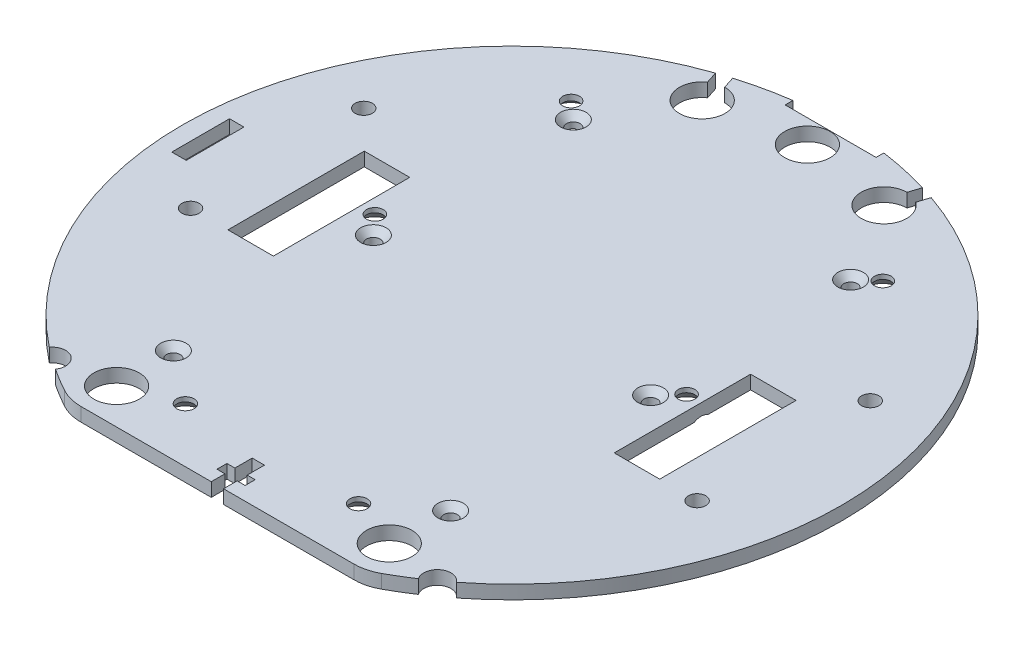
from build123d import *
from OCP.BRepFilletAPI import BRepFilletAPI_MakeChamfer

# Parameters (mm, degrees)
SKETCH1_W           = 3.175
SKETCH1_H           = 12.7
BOSS_EXTRUDE1_DEPTH = 3
SKETCH2_R           = 1.5
CUT_EXTRUDE1_DEPTH  = 103.574363269
CHAMFER1_SIZE       = 1.5
CHAMFER1_SIZE2      = 1.303930107
CUT_EXTRUDE2_DEPTH  = 103.574363269
SKETCH4_W           = 20
SKETCH4_H           = 1.7
CUT_EXTRUDE3_DEPTH  = 103.574363269
SKETCH5_R           = 5
CUT_EXTRUDE4_DEPTH  = 103.085748271
SKETCH6_R           = 1.8415
CUT_EXTRUDE5_DEPTH  = 103.085748271
SKETCH8_R           = 1.905
SKETCH8_W           = 10
SKETCH8_H           = 30
CUT_EXTRUDE7_DEPTH  = 103.085748271
CHAMFER2_SIZE       = 2
CHAMFER2_SIZE_2     = 1.738573476


with BuildPart() as part:
    # Sketch1 → Boss-Extrude1 (new body)
    with BuildSketch(Plane(origin=(0, 0, 0), x_dir=(1, 0, 0), z_dir=(0, 1, 0))):
        with BuildLine():
            Line((30.029977361, -64.812867647), (-30.029977361, -64.812867647))
            ThreePointArc((-30.029977361, -64.812867647), (-32.509837414, -64.500503794), (-34.834773739, -63.582926471))
            ThreePointArc((-34.834773739, -63.582926471), (0, 72.5), (34.834773739, -63.582926471))
            ThreePointArc((34.834773739, -63.582926471), (32.509837414, -64.500503794), (30.029977361, -64.812867647))
        make_face()
        with Locations((-66.9125, 0)):
            Rectangle(SKETCH1_W, SKETCH1_H, mode=Mode.SUBTRACT)
    extrude(amount=BOSS_EXTRUDE1_DEPTH)

    # Sketch2 → Cut-Extrude1 (cut, through all)
    with BuildSketch(Plane(origin=(0, 3, 0), x_dir=(1, 0, 0), z_dir=(0, 1, 0))):
        with Locations(Location((-30.5, 44, 0), (0, 0, 270))):
            Circle(SKETCH2_R)
        with Locations(Location((30.5, 44, 0), (0, 0, 270))):
            Circle(SKETCH2_R)
        with Locations(Location((30.5, 0, 0), (0, 0, 270))):
            Circle(SKETCH2_R)
        with Locations(Location((30.5, -44, 0), (0, 0, 270))):
            Circle(SKETCH2_R)
        with Locations(Location((-30.5, -44, 0), (0, 0, 270))):
            Circle(SKETCH2_R)
        with Locations(Location((-30.5, 0, 0), (0, 0, 270))):
            Circle(SKETCH2_R)
    extrude(amount=-CUT_EXTRUDE1_DEPTH, mode=Mode.SUBTRACT)

    # Chamfer1: one chamfer whose edges measure the first distance from different faces: ONE call of the kernel's chamfer builder (chamfer() names one face for all edges)
    chamfer1_edges_1 = [part.edges().sort_by_distance(p)[0] for p in [
        (-30.5, 3, -45.5),
    ]]
    chamfer1_side_1 = [part.faces().sort_by_distance(p)[0] for p in [
        (-30.5, 1.5, -45.5),
    ]]
    chamfer1_edges_2 = [part.edges().sort_by_distance(p)[0] for p in [
        (-30.5, 3, -1.5),
    ]]
    chamfer1_side_2 = [part.faces().sort_by_distance(p)[0] for p in [
        (-30.5, 1.5, -1.5),
    ]]
    chamfer1_edges_3 = [part.edges().sort_by_distance(p)[0] for p in [
        (-30.5, 3, 42.5),
    ]]
    chamfer1_side_3 = [part.faces().sort_by_distance(p)[0] for p in [
        (-30.5, 1.5, 42.5),
    ]]
    chamfer1_edges_4 = [part.edges().sort_by_distance(p)[0] for p in [
        (30.5, 3, 42.5),
    ]]
    chamfer1_side_4 = [part.faces().sort_by_distance(p)[0] for p in [
        (30.5, 1.5, 42.5),
    ]]
    chamfer1_edges_5 = [part.edges().sort_by_distance(p)[0] for p in [
        (30.5, 3, -1.5),
    ]]
    chamfer1_side_5 = [part.faces().sort_by_distance(p)[0] for p in [
        (30.5, 1.5, -1.5),
    ]]
    chamfer1_edges_6 = [part.edges().sort_by_distance(p)[0] for p in [
        (30.5, 3, -45.5),
    ]]
    chamfer1_side_6 = [part.faces().sort_by_distance(p)[0] for p in [
        (30.5, 1.5, -45.5),
    ]]
    chamfer1 = BRepFilletAPI_MakeChamfer(part.part.solid().wrapped)
    for e in chamfer1_edges_1:
        chamfer1.Add(CHAMFER1_SIZE, CHAMFER1_SIZE2, e.wrapped, chamfer1_side_1[0].wrapped)  # the first distance lies on this face
    for e in chamfer1_edges_2:
        chamfer1.Add(CHAMFER1_SIZE, CHAMFER1_SIZE2, e.wrapped, chamfer1_side_2[0].wrapped)  # the first distance lies on this face
    for e in chamfer1_edges_3:
        chamfer1.Add(CHAMFER1_SIZE, CHAMFER1_SIZE2, e.wrapped, chamfer1_side_3[0].wrapped)  # the first distance lies on this face
    for e in chamfer1_edges_4:
        chamfer1.Add(CHAMFER1_SIZE, CHAMFER1_SIZE2, e.wrapped, chamfer1_side_4[0].wrapped)  # the first distance lies on this face
    for e in chamfer1_edges_5:
        chamfer1.Add(CHAMFER1_SIZE, CHAMFER1_SIZE2, e.wrapped, chamfer1_side_5[0].wrapped)  # the first distance lies on this face
    for e in chamfer1_edges_6:
        chamfer1.Add(CHAMFER1_SIZE, CHAMFER1_SIZE2, e.wrapped, chamfer1_side_6[0].wrapped)  # the first distance lies on this face
    add(Compound.cast(chamfer1.Shape()), mode=Mode.REPLACE)

    # Sketch3 → Cut-Extrude2 (cut, through all)
    with BuildSketch(Plane(origin=(0, 3, 0), x_dir=(1, 0, 0), z_dir=(0, 1, 0))):
        Polygon((1.35, -61.812867647), (3.1, -61.812867647), (3.1, -59.612867647), (1.35, -59.612867647), (1.35, -55.812867647), (-1.35, -55.812867647), (-1.35, -59.612867647), (-3.1, -59.612867647), (-3.1, -61.812867647), (-1.35, -61.812867647), (-1.35, -64.812867647), (1.35, -64.812867647), align=None)
    extrude(amount=-CUT_EXTRUDE2_DEPTH, mode=Mode.SUBTRACT)

    # Sketch4 → Cut-Extrude3 (cut, through all)
    with BuildSketch(Plane(origin=(0, 3, 0), x_dir=(1, 0, 0), z_dir=(0, 1, 0))):
        with Locations((0, 70.957033082)):
            Rectangle(SKETCH4_W, SKETCH4_H)
    extrude(amount=-CUT_EXTRUDE3_DEPTH, mode=Mode.SUBTRACT)


with BuildPart() as body_2:
    # of the pieces the cut leaves, the one that is kept (cut_extrude3_keep)
    add(part.part.solids().sort_by_distance((-30.029977361, 3, 64.812867647))[0])

    # Sketch5 → Cut-Extrude4 (cut, through all)
    with BuildSketch(Plane(origin=(0, 3, 0), x_dir=(1, 0, 0), z_dir=(0, 1, 0))):
        with Locations(Location((0, 65, 0), (0, 0, 270))):
            Circle(SKETCH5_R)
        with Locations(Location((30, -57, 0), (0, 0, 90))):
            Circle(SKETCH5_R)
        with Locations(Location((-30, -57, 0), (0, 0, 270))):
            Circle(SKETCH5_R)
    extrude(amount=-CUT_EXTRUDE4_DEPTH, mode=Mode.SUBTRACT)

    # Sketch6 → Cut-Extrude5 (cut, through all)
    with BuildSketch(Plane(origin=(0, 3, 0), x_dir=(1, 0, 0), z_dir=(0, 1, 0))):
        with Locations(Location((-34.29, 47.297033082, 0), (0, 0, 270))):
            Circle(SKETCH6_R)
        with Locations(Location((-34.29, 4.117033082, 0), (0, 0, 270))):
            Circle(SKETCH6_R)
        with Locations(Location((34.29, 4.117033082, 0), (0, 0, 270))):
            Circle(SKETCH6_R)
        with Locations(Location((34.29, 47.297033082, 0), (0, 0, 270))):
            Circle(SKETCH6_R)
    extrude(amount=-CUT_EXTRUDE5_DEPTH, mode=Mode.SUBTRACT)

    # Sketch8 → Cut-Extrude7 (cut, through all)
    with BuildSketch(Plane(origin=(0, 3, 0), x_dir=(1, 0, 0), z_dir=(0, 1, 0))):
        with Locations(Location((55.721466806, -15, 0), (0, 0, 270))):
            Circle(SKETCH8_R)
        with Locations(Location((55.721466806, 23.1, 0), (0, 0, 270))):
            Circle(SKETCH8_R)
        with Locations(Location((19.05, -52.812867647, 0), (0, 0, 270))):
            Circle(SKETCH8_R)
        with Locations(Location((-19.05, -52.812867647, 0), (0, 0, 270))):
            Circle(SKETCH8_R)
        with Locations(Location((-55.721466806, 23.1, 0), (0, 0, 270))):
            Circle(SKETCH8_R)
        with Locations(Location((-55.721466806, -15, 0), (0, 0, 270))):
            Circle(SKETCH8_R)
        with Locations((-42.5, 0)):
            Rectangle(SKETCH8_W, SKETCH8_H)
        with Locations((42.5, 0)):
            Rectangle(SKETCH8_W, SKETCH8_H)
        with BuildLine():
            Line((-23.730146131, 68.506424258), (-22.894827642, 65.923344486))
            ThreePointArc((-22.894827642, 65.923344486), (-18.461538462, 57.089154816), (-20.040369901, 66.846421409))
            Line((-20.040369901, 66.846421409), (-20.87568839, 69.429501181))
            ThreePointArc((-20.87568839, 69.429501181), (-22.764455722, 70.39519159), (-23.730146131, 68.506424258))
        make_face()
        with BuildLine():
            Line((20.040369901, 66.846421409), (20.87568839, 69.429501181))
            ThreePointArc((20.87568839, 69.429501181), (22.764455722, 70.39519159), (23.730146131, 68.506424258))
            Line((23.730146131, 68.506424258), (22.894827642, 65.923344486))
            ThreePointArc((22.894827642, 65.923344486), (18.461538462, 57.089154816), (20.040369901, 66.846421409))
        make_face()
        with BuildLine():
            ThreePointArc((39.925125077, -60.516397675), (40.640278394, -56.379231744), (44.791355024, -57.008635443))
            ThreePointArc((44.791355024, -57.008635443), (42.394535015, -58.812867647), (39.925125077, -60.516397675))
        make_face()
        with BuildLine():
            ThreePointArc((-39.925125077, -60.516397675), (-40.640278394, -56.379231744), (-44.791355024, -57.008635443))
            ThreePointArc((-44.791355024, -57.008635443), (-42.394535015, -58.812867647), (-39.925125077, -60.516397675))
        make_face()
    extrude(amount=-CUT_EXTRUDE7_DEPTH, mode=Mode.SUBTRACT)

    # Chamfer2
    # the kernel refuses this chamfer: 2, 1.738573476 mm, written as the material it takes off along each edge
    with BuildSketch(Plane(origin=(-19.05, 0, 52.812867647), x_dir=(0, 0, 1), z_dir=(-1, 0, 0))) as chamfer2_piece_1:
        Polygon((1.905, CHAMFER2_SIZE), (1.905 + CHAMFER2_SIZE_2, 0), (1.905, 0), align=None)
    revolve(axis=Axis((-19.05, 0, 52.812867647), (0, 1, 0)), mode=Mode.SUBTRACT)
    with BuildSketch(Plane(origin=(19.05, 0, 52.812867647), x_dir=(0, 0, 1), z_dir=(-1, 0, 0))) as chamfer2_piece_2:
        Polygon((1.905, CHAMFER2_SIZE), (1.905 + CHAMFER2_SIZE_2, 0), (1.905, 0), align=None)
    revolve(axis=Axis((19.05, 0, 52.812867647), (0, 1, 0)), mode=Mode.SUBTRACT)
    with BuildSketch(Plane(origin=(-34.29, 0, -47.297033082), x_dir=(0, 0, 1), z_dir=(-1, 0, 0))) as chamfer2_piece_3:
        Polygon((1.8415, CHAMFER2_SIZE_2), (1.8415 + CHAMFER2_SIZE, 0), (1.8415, 0), align=None)
    revolve(axis=Axis((-34.29, 0, -47.297033082), (0, 1, 0)), mode=Mode.SUBTRACT)
    with BuildSketch(Plane(origin=(-34.29, 0, -4.117033082), x_dir=(0, 0, 1), z_dir=(-1, 0, 0))) as chamfer2_piece_4:
        Polygon((1.8415, CHAMFER2_SIZE), (1.8415 + CHAMFER2_SIZE_2, 0), (1.8415, 0), align=None)
    revolve(axis=Axis((-34.29, 0, -4.117033082), (0, 1, 0)), mode=Mode.SUBTRACT)
    with BuildSketch(Plane(origin=(34.29, 0, -4.117033082), x_dir=(0, 0, 1), z_dir=(-1, 0, 0))) as chamfer2_piece_5:
        Polygon((1.8415, CHAMFER2_SIZE), (1.8415 + CHAMFER2_SIZE_2, 0), (1.8415, 0), align=None)
    revolve(axis=Axis((34.29, 0, -4.117033082), (0, 1, 0)), mode=Mode.SUBTRACT)
    with BuildSketch(Plane(origin=(34.29, 0, -47.297033082), x_dir=(0, 0, 1), z_dir=(-1, 0, 0))) as chamfer2_piece_6:
        Polygon((1.8415, CHAMFER2_SIZE), (1.8415 + CHAMFER2_SIZE_2, 0), (1.8415, 0), align=None)
    revolve(axis=Axis((34.29, 0, -47.297033082), (0, 1, 0)), mode=Mode.SUBTRACT)


solid = body_2.part
